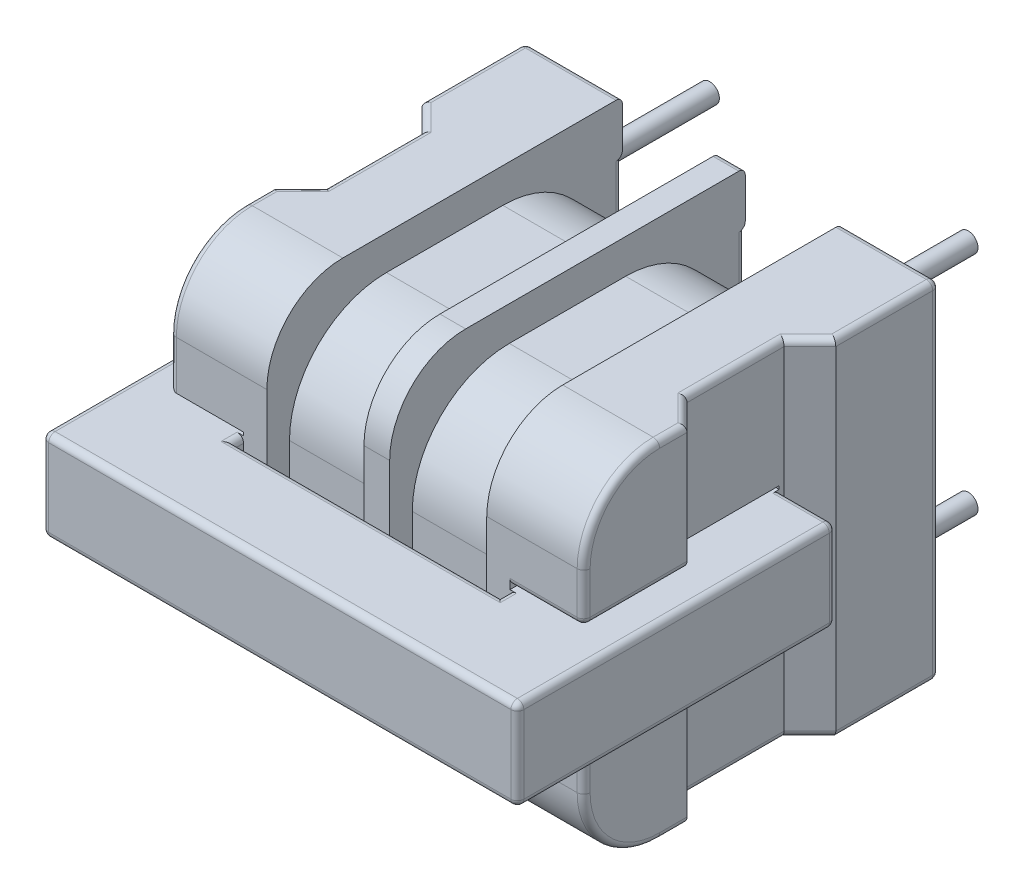
from build123d import *

# Parameters (mm, degrees)
SKETCH1_W                = 14.7
SKETCH1_H                = 10.7
BOSS_EXTRUDE1_DEPTH      = 14
SKETCH3_W                = 3
SKETCH3_H                = 1
CUT_EXTRUDE1_START       = 14
SKETCH4_W                = 14.7
SKETCH4_H                = 3.95
CUT_EXTRUDE1_DEPTH       = 3
FILLET1_R                = 2.35
FILLET2_R                = 0.2
SKETCH5_W                = 3.003795499
SKETCH5_H                = 1.511446801
SKETCH5_H_2              = 1.627749811
SKETCH5_W_2              = 0.95
SKETCH5_H_3              = 3.95
CUT_EXTRUDE2_DEPTH       = 17.692663059
SKETCH6_W                = 3
SKETCH6_H                = 2.35
SKETCH6_W_2              = 3.003795499
SKETCH6_H_2              = 2.390981303
CUT_EXTRUDE3_DEPTH       = 1
CUT_EXTRUDE4_START       = 10
SKETCH7_W                = 3.003795499
SKETCH7_H                = 2.35
CUT_EXTRUDE4_DEPTH       = 1
CUT_EXTRUDE5_START       = 1.4
CUT_EXTRUDE5_DEPTH       = 3.95
CUT_EXTRUDE6_START       = -5.35
CUT_EXTRUDE6_DEPTH       = 3.95
CUT_EXTRUDE7_DEPTH       = 17.692663059
CUT_EXTRUDE7_DEPTH_BACK  = 17.692663059
SKETCH10_W               = 8.24
SKETCH10_H               = 0.3
CUT_EXTRUDE8_START       = 4.15
SKETCH11_W               = 3.23
SKETCH11_H               = 0.1
CUT_EXTRUDE8_DEPTH       = 6.85
FILLET3_R                = 0.2
FILLET4_R                = 3
BOSS_EXTRUDE2_DEPTH      = 1
BOSS_EXTRUDE2_DEPTH_BACK = 3.3
SKETCH16_R               = 0.3


with BuildPart() as part:
    # Sketch1 → Boss-Extrude1 (new body)
    with BuildSketch(Plane.XY):
        Rectangle(SKETCH1_W, SKETCH1_H)
    extrude(amount=BOSS_EXTRUDE1_DEPTH)

    # Cut-Sweep1: sweep along a path in Sketch2
    with BuildLine(Plane(origin=(0, 0, 0), x_dir=(0, 0, -1), z_dir=(1, 0, 0))) as cut_sweep1_path:
        Line((-7, 4.5), (-4, 4.5))
        ThreePointArc((-4, 4.5), (-1.878679656, 3.621320344), (-1, 1.5))
        Line((-1, 1.5), (-1, -1.5))
        ThreePointArc((-1, -1.5), (-1.878679656, -3.621320344), (-4, -4.5))
        Line((-4, -4.5), (-7, -4.5))
        ThreePointArc((-7, -4.5), (-9.121320344, -3.621320344), (-10, -1.5))
        Line((-10, -1.5), (-10, 1.5))
        ThreePointArc((-10, 1.5), (-9.121320344, 3.621320344), (-7, 4.5))
    # Sketch3 → Cut-Sweep1 (sweep, cut)
    with BuildSketch(Plane(origin=(0, 0, 0), x_dir=(1, 0, 0), z_dir=(0, 1, 0))):
        with Locations((-1.9, -10.8)):
            Rectangle(SKETCH3_W, SKETCH3_H)
        with Locations((1.9, -10.8)):
            Rectangle(SKETCH3_W, SKETCH3_H)
    sweep(path=cut_sweep1_path.line, mode=Mode.SUBTRACT)

    # Sketch4 → Cut-Extrude1 (cut)
    with BuildSketch(Plane.XY.offset(CUT_EXTRUDE1_START)):
        with Locations((0, 3.375)):
            Rectangle(SKETCH4_W, SKETCH4_H)
        with Locations((0, -3.375)):
            Rectangle(SKETCH4_W, SKETCH4_H)
    extrude(amount=-CUT_EXTRUDE1_DEPTH, mode=Mode.SUBTRACT)

    # Fillet1
    # the kernel refuses this fillet: 2.35 mm, written as the material it takes off along each edge
    with BuildSketch(Plane(origin=(-13.225, -5.35, 11), x_dir=(0, 0, -1), z_dir=(1, 0, 0))) as fillet1_piece_1:
        with BuildLine():
            CenterArc((FILLET1_R, FILLET1_R), FILLET1_R, 180, 90)
            Line((0, FILLET1_R), (0, 0))
            Line((0, 0), (FILLET1_R, 0))
        make_face()
    extrude(amount=26.45, mode=Mode.SUBTRACT)
    with BuildSketch(Plane(origin=(-13.225, 5.35, 11), x_dir=(0, 0, -1), z_dir=(1, 0, 0))) as fillet1_piece_2:
        with BuildLine():
            CenterArc((FILLET1_R, -FILLET1_R), FILLET1_R, 90, 90)
            Line((0, -FILLET1_R), (0, 0))
            Line((0, 0), (FILLET1_R, 0))
        make_face()
    extrude(amount=26.45, mode=Mode.SUBTRACT)

    # Fillet2
    fillet2_edges = [part.edges().sort_by_distance(p)[0] for p in [
        (-3.4, 0, 0),
        (-1.9, -3.077973384, 0),
        (-1.9, 3.077973384, 0),
        (-0.4, 0, 0),
        (0, -5.35, 0),
        (-7.35, 0, 0),
        (0, 5.35, 0),
        (7.35, 0, 0),
        (0.4, 0, 0),
        (1.9, -3.077973384, 0),
        (1.9, 3.077973384, 0),
        (3.4, 0, 0),
    ]]
    fillet(fillet2_edges, radius=FILLET2_R)

    # Sketch5 → Cut-Extrude2 (cut, through all)
    with BuildSketch(Plane.XY):
        with Locations((-1.898102251, 5.04060171)):
            Rectangle(SKETCH5_W, SKETCH5_H)
        with Locations((1.90189775, 5.04060171)):
            Rectangle(SKETCH5_W, SKETCH5_H)
        with Locations((-1.898102251, -5.231912299)):
            Rectangle(SKETCH5_W, SKETCH5_H_2)
        with Locations((1.90189775, -5.231912299)):
            Rectangle(SKETCH5_W, SKETCH5_H_2)
        with Locations((-6.875, 3.375)):
            Rectangle(SKETCH5_W_2, SKETCH5_H_3)
        with Locations((-6.875, -3.375)):
            Rectangle(SKETCH5_W_2, SKETCH5_H_3)
        with Locations((6.875, 3.375)):
            Rectangle(SKETCH5_W_2, SKETCH5_H_3)
        with Locations((6.875, -3.375)):
            Rectangle(SKETCH5_W_2, SKETCH5_H_3)
    extrude(amount=CUT_EXTRUDE2_DEPTH, mode=Mode.SUBTRACT)

    # Sketch6 → Cut-Extrude3 (cut)
    with BuildSketch(Plane.XY):
        with Locations((-1.9, 4.175)):
            Rectangle(SKETCH6_W, SKETCH6_H)
        with Locations((1.90189775, 4.175)):
            Rectangle(SKETCH6_W_2, SKETCH6_H)
        with Locations((-1.9, -4.175)):
            Rectangle(SKETCH6_W, SKETCH6_H)
        with Locations((1.90189775, -4.154509349)):
            Rectangle(SKETCH6_W_2, SKETCH6_H_2)
    extrude(amount=CUT_EXTRUDE3_DEPTH, mode=Mode.SUBTRACT)

    # Sketch7 → Cut-Extrude4 (cut)
    with BuildSketch(Plane.XY.offset(CUT_EXTRUDE4_START)):
        with Locations((-1.898102251, 4.175)):
            Rectangle(SKETCH7_W, SKETCH7_H)
        with Locations((1.90189775, 4.175)):
            Rectangle(SKETCH7_W, SKETCH7_H)
        with Locations((-1.898102251, -4.175)):
            Rectangle(SKETCH7_W, SKETCH7_H)
        with Locations((1.90189775, -4.175)):
            Rectangle(SKETCH7_W, SKETCH7_H)
    extrude(amount=CUT_EXTRUDE4_DEPTH, mode=Mode.SUBTRACT)

    # Sketch8 → Cut-Extrude5 (cut)
    with BuildSketch(Plane(origin=(0, 0, 0), x_dir=(1, 0, 0), z_dir=(0, 1, 0)).offset(CUT_EXTRUDE5_START)):
        Polygon((-6.4, -3.2), (-5.6, -4), (-5.6, -7), (-6.4, -7.8), align=None)
        Polygon((6.4, -3.2), (6.4, -7.8), (5.6, -7), (5.6, -4), align=None)
    extrude(amount=CUT_EXTRUDE5_DEPTH, mode=Mode.SUBTRACT)

    # Sketch9 → Cut-Extrude6 (cut)
    with BuildSketch(Plane(origin=(0, 0, 0), x_dir=(1, 0, 0), z_dir=(0, 1, 0)).offset(CUT_EXTRUDE6_START)):
        Polygon((-6.4, -3.2), (-5.6, -4), (-5.6, -7), (-6.4, -7.8), align=None)
        Polygon((6.4, -3.2), (5.6, -4), (5.6, -7), (6.4, -7.8), align=None)
    extrude(amount=CUT_EXTRUDE6_DEPTH, mode=Mode.SUBTRACT)

    # Sketch10 → Cut-Extrude7 (cut, two sides: drawn at the far end of the back side and taken through both)
    with BuildSketch(Plane(origin=(0, 0, 0), x_dir=(1, 0, 0), z_dir=(0, 1, 0)).offset(-CUT_EXTRUDE7_DEPTH_BACK)):
        with Locations((0, -11.15)):
            Rectangle(SKETCH10_W, SKETCH10_H)
        Polygon((-6.4, 0), (-6.4, -3.2), (-5.6, -4), (-5.6, -4.15), (-7.35, -4.15), (-7.35, 0), align=None)
        Polygon((6.4, 0), (6.4, -3.2), (5.6, -4), (5.6, -4.15), (7.35, -4.15), (7.35, 0), align=None)
    extrude(amount=CUT_EXTRUDE7_DEPTH + CUT_EXTRUDE7_DEPTH_BACK, mode=Mode.SUBTRACT)

    # Sketch11 → Cut-Extrude8 (cut)
    with BuildSketch(Plane.XY.offset(CUT_EXTRUDE8_START)):
        with Locations((-5.735, 1.45)):
            Rectangle(SKETCH11_W, SKETCH11_H)
        with Locations((-5.735, -1.45)):
            Rectangle(SKETCH11_W, SKETCH11_H)
        with Locations((5.735, 1.45)):
            Rectangle(SKETCH11_W, SKETCH11_H)
        with Locations((5.735, -1.45)):
            Rectangle(SKETCH11_W, SKETCH11_H)
    extrude(amount=CUT_EXTRUDE8_DEPTH, mode=Mode.SUBTRACT)

    # Fillet3
    fillet3_edges = [part.edges().sort_by_distance(p)[0] for p in [
        (-6.4, 2.25, 11),
        (-6, 1.5, 7.4),
        (-6.4, 1.5, 9.4),
        (-6, -1.5, 7.4),
        (-6.4, -1.5, 9.4),
        (6, 1.5, 7.4),
        (6.4, 1.5, 9.4),
        (5.26, 1.5, 11),
        (6, -1.5, 7.4),
        (6.4, -2.25, 11),
        (6.4, -1.5, 9.4),
        (5.26, -1.5, 11),
        (0, 1.4, 11.3),
        (-7.35, 0, 14),
        (0, 1.4, 14),
        (0, -1.4, 11.3),
        (7.35, 0, 14),
        (0, -1.4, 14),
        (-6.4, 5.35, 8.225),
        (-6.4, 0, 0),
        (-6.4, 4.661700936, 10.311700936),
        (-6.4, -2.25, 11),
        (-6.4, -5.35, 8.225),
        (-6.4, -4.661700936, 10.311700936),
        (6.4, 2.25, 11),
        (6.4, 5.35, 8.225),
        (6.4, 0, 0),
        (6.4, 4.661700936, 10.311700936),
        (6.4, -5.35, 8.225),
        (6.4, -4.661700936, 10.311700936),
        (-6.4, 5.35, 1.7),
        (-6, 5.35, 7.4),
        (-5.6, 5.35, 5.5),
        (-6, 5.35, 3.6),
        (6.4, 5.35, 1.7),
        (6, 5.35, 3.6),
        (5.6, 5.35, 5.5),
        (6, 5.35, 7.4),
        (-6.4, -5.35, 1.7),
        (-6, -5.35, 3.6),
        (-5.6, -5.35, 5.5),
        (-6, -5.35, 7.4),
        (6.4, -5.35, 1.7),
        (6, -5.35, 7.4),
        (5.6, -5.35, 5.5),
        (6, -5.35, 3.6),
        (-4.12, -1.4, 11.15),
        (4.12, -1.4, 11.15),
        (-4.12, 1.4, 11.15),
        (4.12, 1.4, 11.15),
        (-7.35, -1.4, 9.075),
        (-7.35, 1.4, 9.075),
        (-6.475, 1.4, 4.15),
        (-6.475, -1.4, 4.15),
        (-7.35, 0, 4.15),
        (7.35, -1.4, 9.075),
        (7.35, 1.4, 9.075),
        (6.475, 1.4, 4.15),
        (6.475, -1.4, 4.15),
        (7.35, 0, 4.15),
        (-6.4, 5.291421356, 0.058578644),
        (-6.4, -5.291421356, 0.058578644),
        (6.4, 5.291421356, 0.058578644),
        (6.4, -5.291421356, 0.058578644),
    ]]
    fillet(fillet3_edges, radius=FILLET3_R)

    # Fillet4
    # the kernel refuses this fillet: 3 mm, written as the material it takes off along each edge
    with BuildSketch(Plane(origin=(-0.4, -4.418037393, 2.458877756), x_dir=(0, 0.8626657179945427, -0.5057745139851947), z_dir=(-1, 0, 0)), Plane(origin=(3.4, -4.418037393, 2.458877756), x_dir=(0, 0.862665717994543, -0.5057745139851944), z_dir=(-1, 0, 0))) as fillet4_piece_1:
        with BuildLine():
            CenterArc((1.960269154, -2.587997154), FILLET4_R, 59.617220167, 90)
            Line((-0.627728, -1.070673612), (-0.886527715, -0.918941258))
            Line((-0.886527715, -0.918941258), (-0.258799715, 0.151732354))
            Line((-0.258799715, 0.151732354), (-0.157984588, 0.255031116))
            ThreePointArc((-0.157984588, 0.255031116), (3.558618719, 0.300254313), (3.62932505, 0.258799715))
            Line((3.62932505, 0.258799715), (3.477592696, 0))
        make_face()
    extrude(amount=3, mode=Mode.SUBTRACT)
    with BuildSketch(Plane(origin=(3.4, -4.418037393, 8.541122244), x_dir=(0, 0.8626657179945425, 0.5057745139851951), z_dir=(-1, 0, 0)), Plane(origin=(-0.4, -4.418037393, 8.541122244), x_dir=(0, 0.8626657179945423, 0.5057745139851956), z_dir=(-1, 0, 0))) as fillet4_piece_2:
        with BuildLine():
            CenterArc((1.960269154, 2.587997154), FILLET4_R, 210.382779833, 90)
            Line((-0.627728, 1.070673612), (-0.886527715, 0.918941258))
            Line((-0.886527715, 0.918941258), (-0.258799715, -0.151732354))
            Line((-0.258799715, -0.151732354), (-0.157984588, -0.255031116))
            ThreePointArc((-0.157984588, -0.255031116), (3.558618719, -0.300254313), (3.62932505, -0.258799715))
            Line((3.62932505, -0.258799715), (3.477592696, 0))
        make_face()
    extrude(amount=3, mode=Mode.SUBTRACT)
    with BuildSketch(Plane(origin=(3.4, 4.284878309, 2.22956141), x_dir=(0, -0.8908881644827965, -0.45422271892153715), z_dir=(-1, 0, 0)), Plane(origin=(-0.4, 4.284878309, 2.22956141), x_dir=(0, -0.8908881644827963, -0.4542227189215376), z_dir=(-1, 0, 0))) as fillet4_piece_3:
        with BuildLine():
            CenterArc((2.004757879, 2.672664493), FILLET4_R, 207.014933743, 90)
            Line((-0.667906614, 1.309996337), (-0.935173064, 1.173729521))
            Line((-0.935173064, 1.173729521), (-0.267266449, -0.136266816))
            Line((-0.267266449, -0.136266816), (-0.152440154, -0.258383435))
            ThreePointArc((-0.152440154, -0.258383435), (3.312043483, -0.364979609), (3.503692851, -0.267266449))
            Line((3.503692851, -0.267266449), (3.367426036, 0))
        make_face()
    extrude(amount=3, mode=Mode.SUBTRACT)
    with BuildSketch(Plane(origin=(3.4, 4.284878309, 8.77043859), x_dir=(0, 0, -1), z_dir=(-1, 0, 0)), Plane(origin=(-0.4, 4.284878309, 8.77043859), x_dir=(0, 0, -1), z_dir=(-1, 0, 0))) as fillet4_piece_4:
        with BuildLine():
            CenterArc((1.47043859, 3), FILLET4_R, 180, 90)
            Line((-1.52956141, 3), (-1.82956141, 3))
            ThreePointArc((-1.82956141, 3), (-1.82956141, 2.784878309), (-0.160948963, -0.253170755))
            Line((-0.160948963, -0.253170755), (0, -0.3))
            Line((0, -0.3), (1.47043859, -0.3))
            Line((1.47043859, -0.3), (1.47043859, 0))
        make_face()
    extrude(amount=3, mode=Mode.SUBTRACT)

    # Sketch16 → Boss-Extrude2 (add, two sides: drawn at the far end of the back side and taken through both)
    with BuildSketch(Plane.XY.offset(-BOSS_EXTRUDE2_DEPTH_BACK)):
        with Locations((-4, 3.5)):
            Circle(SKETCH16_R)
        with Locations((4, 3.5)):
            Circle(SKETCH16_R)
        with Locations((4, -3.5)):
            Circle(SKETCH16_R)
        with Locations((-4, -3.5)):
            Circle(SKETCH16_R)
    extrude(amount=BOSS_EXTRUDE2_DEPTH + BOSS_EXTRUDE2_DEPTH_BACK)


solid = part.part
